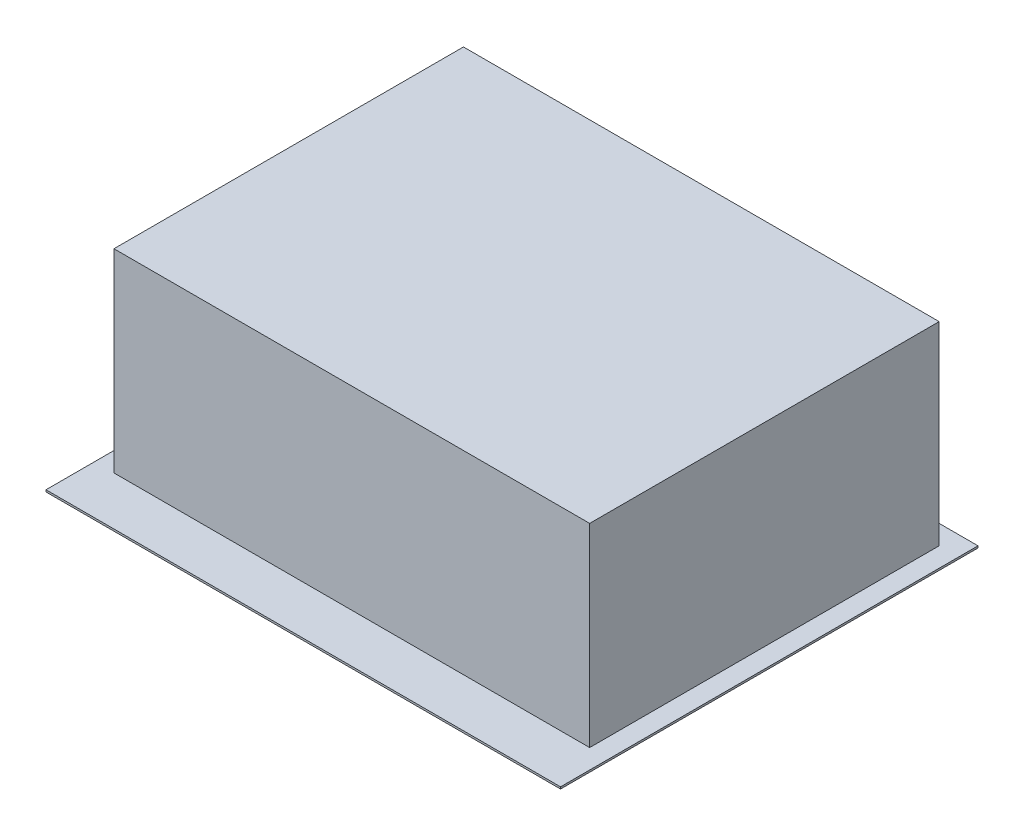
from build123d import *

# Parameters (mm, degrees)
SKETCH_1_W                = 530
SKETCH_1_H                = 430
EXTRUDE_1_DEPTH           = 2
EXTRUDE_1_2_OUTLINE_W     = 490
EXTRUDE_1_2_OUTLINE_H     = 360
EXTRUDE_1_2_DEPTH         = 10
EXTRUDE_START             = 190
EXTRUDE_1_2_2_OUTLINE_W   = 490
EXTRUDE_1_2_2_OUTLINE_H   = 360
EXTRUDE_1_2_2_DEPTH       = 10
EXTRUDE_START_2           = 10
EXTRUDE_1_2_3_OUTLINE_W   = 490
EXTRUDE_1_2_3_OUTLINE_H   = 360
EXTRUDE_1_2_3_OUTLINE_W_2 = 486
EXTRUDE_1_2_3_OUTLINE_H_2 = 356
EXTRUDE_1_2_3_DEPTH       = 180
SKETCH_3_W                = 486
SKETCH_3_H                = 350
CUT_EXTRUDE_1_DEPTH       = 200


# Read off the part's stored shape, not the designer's step: Вытянуть-Тонкостенный1
with BuildPart() as part:
    # Эскиз1 → Extrude 1 (new body)
    with BuildSketch(Plane(origin=(0, 0, 0), x_dir=(1, 0, 0), z_dir=(0, 1, 0))):
        with Locations((265, 215)):
            Rectangle(SKETCH_1_W, SKETCH_1_H)
    extrude(amount=EXTRUDE_1_DEPTH)

    # Extrude 1 2 outline → Extrude 1 2 (add)
    with BuildSketch(Plane(origin=(0, 2, 0), x_dir=(1, 0, 0), z_dir=(0, 1, 0))):
        with Locations((265, 230)):
            Rectangle(EXTRUDE_1_2_OUTLINE_W, EXTRUDE_1_2_OUTLINE_H)
    extrude(amount=EXTRUDE_1_2_DEPTH)



with BuildPart() as body_2:
    # Extrude 1 2 2 outline → Extrude 1 2 2 (new body)
    with BuildSketch(Plane(origin=(0, 2, 0), x_dir=(1, 0, 0), z_dir=(0, 1, 0)).offset(EXTRUDE_START)):
        with Locations((265, 230)):
            Rectangle(EXTRUDE_1_2_2_OUTLINE_W, EXTRUDE_1_2_2_OUTLINE_H)
    extrude(amount=EXTRUDE_1_2_2_DEPTH)


with BuildPart() as part_1:
    add(part.part)

    add(body_2.part)  # Extrude 1 2 3 merges body 2
    # Extrude 1 2 3 outline → Extrude 1 2 3 (add)
    with BuildSketch(Plane(origin=(0, 2, 0), x_dir=(1, 0, 0), z_dir=(0, 1, 0)).offset(EXTRUDE_START_2)):
        with Locations((265, 230)):
            Rectangle(EXTRUDE_1_2_3_OUTLINE_W, EXTRUDE_1_2_3_OUTLINE_H)
        with Locations((265, 230)):
            Rectangle(EXTRUDE_1_2_3_OUTLINE_W_2, EXTRUDE_1_2_3_OUTLINE_H_2, mode=Mode.SUBTRACT)
    extrude(amount=EXTRUDE_1_2_3_DEPTH)

    # Эскиз3 → Вырез-Вытянуть1 (cut)
    with BuildSketch(Plane.XZ):
        with Locations((265, -227)):
            Rectangle(SKETCH_3_W, SKETCH_3_H)
    extrude(amount=-CUT_EXTRUDE_1_DEPTH, mode=Mode.SUBTRACT)


solid = part_1.part
